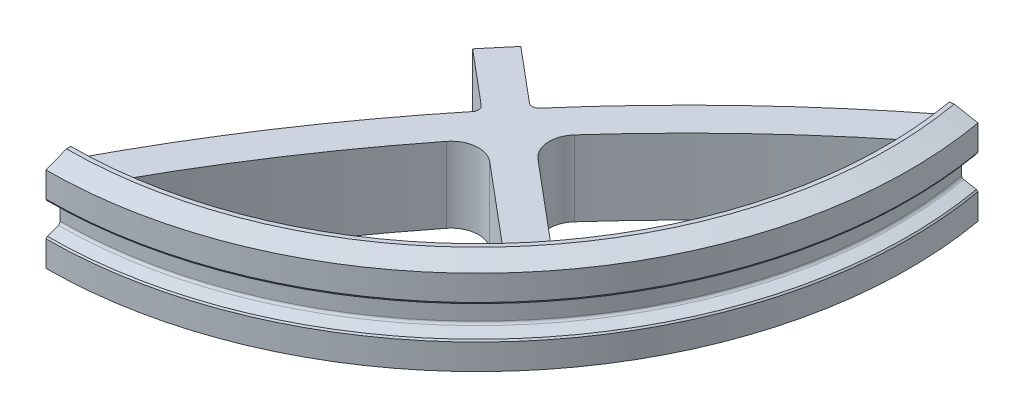
from build123d import *

# Parameters (mm, degrees)
REVOLVE5_ANGLE           = 100
BOSS_EXTRUDE1_DEPTH      = 7.62
BOSS_EXTRUDE1_DEPTH_BACK = 6.35


with BuildPart() as part:
    # Sketch2 → Revolve5 (revolve)
    with BuildSketch(Plane(origin=(0, 0, 0), x_dir=(0, 0, -1), z_dir=(1, 0, 0))):
        with BuildLine():
            Line((8.30436622, 9.401920301), (7.503364151, 9.401920301))
            Line((7.503364151, 9.401920301), (3.703353764, 7.901920301))
            Line((3.703353764, 7.901920301), (3.703353764, 3.210332207))
            Line((3.703353764, 3.210332207), (3.889015818, 2.888756769))
            Line((3.889015818, 2.888756769), (5.996607163, 2.121657669))
            ThreePointArc((5.996607163, 2.121657669), (6.238990142, 1.935670839), (6.330860906, 1.644294154))
            Line((6.330860906, 1.644294154), (6.330860906, -1.644294154))
            ThreePointArc((6.330860906, -1.644294154), (6.238990142, -1.935670839), (5.996607163, -2.121657669))
            Line((5.996607163, -2.121657669), (3.942036829, -2.869458735))
            Line((3.942036829, -2.869458735), (3.703353764, -3.1539083))
            Line((3.703353764, -3.1539083), (3.703353764, -7.901919468))
            Line((3.703353764, -7.901919468), (7.503364151, -9.401919468))
            Line((7.503364151, -9.401919468), (8.30436622, -9.401919468))
            Line((8.30436622, -9.401919468), (8.30436622, 9.401920301))
        make_face()
    revolve(axis=Axis((0, 6.004859942, -83.82), (0, 1, 0)), revolution_arc=REVOLVE5_ANGLE)

    # Sketch4 → Boss-Extrude1 (add, two sides: drawn at the far end of the back side and taken through both)
    with BuildSketch(Plane(origin=(0, 0, 0), x_dir=(1, 0, 0), z_dir=(0, 1, 0)).offset(-BOSS_EXTRUDE1_DEPTH_BACK)):
        with BuildLine():
            Line((0, 7.503364151), (7.382277656, 7.861255382))
            ThreePointArc((7.382277656, 7.861255382), (19.017713164, 27.339633999), (32.271093997, 45.755347114))
            ThreePointArc((32.271093997, 45.755347114), (35.741204926, 47.66779712), (39.529344107, 46.506273796))
            Line((39.529344107, 46.506273796), (56.370469031, 32.374892083))
            Line((56.370469031, 32.374892083), (60.452170353, 37.239274297))
            Line((60.452170353, 37.239274297), (43.611045428, 51.370656009))
            ThreePointArc((43.611045428, 51.370656009), (41.809364788, 54.899548435), (43.090181942, 58.64903404))
            ThreePointArc((43.090181942, 58.64903404), (58.924693565, 74.898921261), (76.086679671, 89.739973311))
            Line((76.086679671, 89.739973311), (75.157214668, 97.072244741))
            ThreePointArc((75.157214668, 97.072244741), (54.436613707, 79.394748667), (35.585688792, 59.735659128))
            ThreePointArc((35.585688792, 59.735659128), (34.726610364, 59.301674652), (33.809864863, 59.594823007))
            Line((33.809864863, 59.594823007), (23.907503444, 67.903890821))
            Line((23.907503444, 67.903890821), (19.825802123, 63.039508608))
            Line((19.825802123, 63.039508608), (29.728163541, 54.730440793))
            ThreePointArc((29.728163541, 54.730440793), (30.1760495, 53.878527394), (29.897835627, 52.957139684))
            ThreePointArc((29.897835627, 52.957139684), (13.810840591, 30.978837603), (0, 7.503364151))
        make_face()
    extrude(amount=BOSS_EXTRUDE1_DEPTH + BOSS_EXTRUDE1_DEPTH_BACK)


solid = part.part
